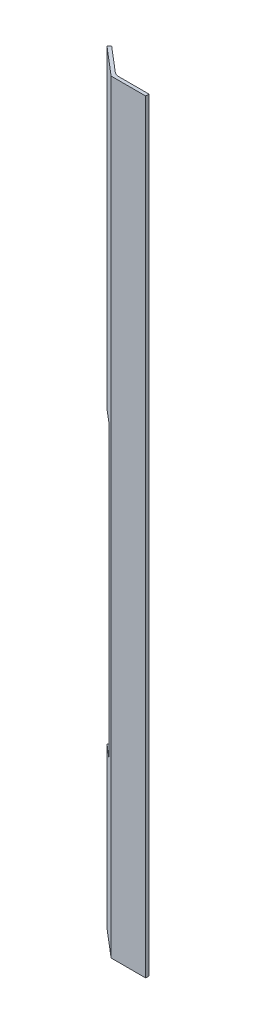
from build123d import *

# Parameters (mm, degrees)
EXTRUDE_START       = 40
EXTRUDE_1_DEPTH     = 460
SKETCH_2_W          = 16.993221306
SKETCH_2_H          = 174.961932369
CUT_EXTRUDE_1_DEPTH = 501.666670065


with BuildPart() as part:
    # Эскиз1 → Вытянуть1 (new body)
    with BuildSketch(Plane(origin=(0, 0, 0), x_dir=(1, 0, 0), z_dir=(0, 1, 0)).offset(EXTRUDE_START)):
        with BuildLine():
            Line((-20.508447565, 12.792651291), (-19.211965496, 14.315521688))
            Line((-19.211965496, 14.315521688), (-4.37520086, 1.680230584))
            ThreePointArc((-4.37520086, 1.680230584), (-2.860623355, 0.794693725), (-1.133379225, 0.48688167))
            Line((-1.133379225, 0.48688167), (17.122829042, 0.48688167))
            Line((17.122829042, 0.48688167), (17.122829042, -1.51311833))
            Line((17.122829042, -1.51311833), (-3.70464164, -1.51311833))
            Line((-3.70464164, -1.51311833), (-20.508447565, 12.792651291))
        make_face()
    extrude(amount=EXTRUDE_1_DEPTH)

    # Эскиз2 → Вырез-Вытянуть1 (cut, through all)
    with BuildSketch(Plane(origin=(-2.30361675, 0, 2.705868318), x_dir=(0.7614351985155554, 0, 0.6482410342315402), z_dir=(-0.6482410342315401, 0, 0.7614351985155553))):
        with Locations((-21.202343366, 223.422280108)):
            Rectangle(SKETCH_2_W, SKETCH_2_H)
    extrude(amount=-CUT_EXTRUDE_1_DEPTH, mode=Mode.SUBTRACT)


solid = part.part
